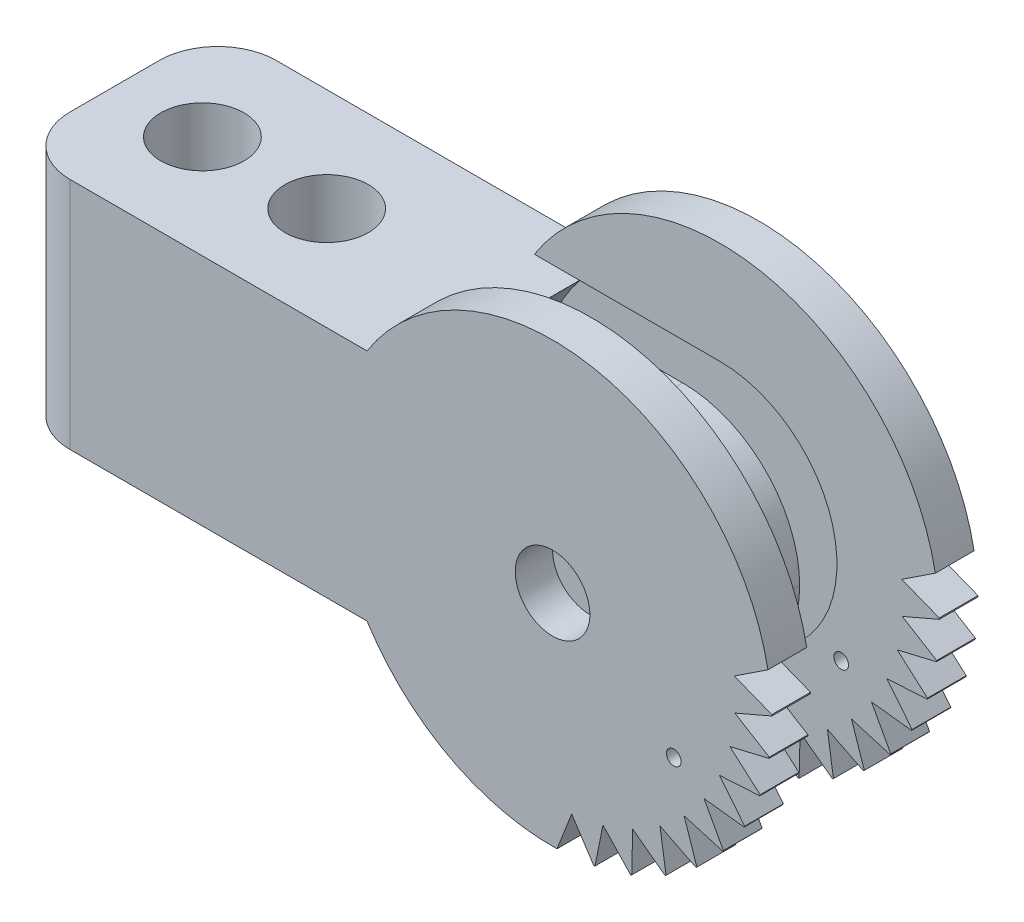
from build123d import *

# Parameters (mm, degrees)
SKETCH1_W           = 45
SKETCH1_H           = 16
BOSS_EXTRUDE1_DEPTH = 14.1
FILLET1_R           = 8
SKETCH2_R           = 1.65
CUT_EXTRUDE1_DEPTH  = 21.1
SKETCH4_R           = 12.5
CUT_EXTRUDE2_DEPTH  = 2.65
BOSS_EXTRUDE3_DEPTH = 2.65
SKETCH7_R           = 0.5
CUT_EXTRUDE3_DEPTH  = 2.65
FILLET2_R           = 4
SKETCH8_R           = 2.55
CUT_EXTRUDE4_DEPTH  = 21.65
SKETCH9_R           = 2.85
CUT_EXTRUDE5_DEPTH  = 6


with BuildPart() as part:
    # Sketch1 → Boss-Extrude1 (new body)
    with BuildSketch(Plane.XY):
        with Locations((-14.5, 0)):
            Rectangle(SKETCH1_W, SKETCH1_H)
    extrude(amount=BOSS_EXTRUDE1_DEPTH)

    # Fillet1
    fillet1_edges = [part.edges().sort_by_distance(p)[0] for p in [
        (8, -8, 7.05),
        (8, 8, 7.05),
    ]]
    fillet(fillet1_edges, radius=FILLET1_R - 0.0001)  # a hair under: the kernel refuses the full size

    # Sketch2 → Cut-Extrude1 (cut)
    with BuildSketch(Plane.XZ.offset(8)):
        with Locations((-22.5, 7.05)):
            Circle(SKETCH2_R)
        with Locations((-31, 7.05)):
            Circle(SKETCH2_R)
    extrude(amount=-CUT_EXTRUDE1_DEPTH, mode=Mode.SUBTRACT)

    # Sketch4 → Cut-Extrude2 (cut)
    with BuildSketch(Plane(origin=(0, 0, 2.55), x_dir=(-1, 0, 0), z_dir=(0, 0, -1))):
        Circle(SKETCH4_R)
    cut_extrude2 = extrude(amount=-CUT_EXTRUDE2_DEPTH, mode=Mode.SUBTRACT)

    # Mirror1: Cut-Extrude2 across plane
    add(cut_extrude2.mirror(Plane(origin=(0, 0, 7.05), x_dir=(1, 0, 0), z_dir=(0, 0, -1))), mode=Mode.SUBTRACT)

    # Sketch6 → Boss-Extrude3 (add)
    with BuildSketch(Plane(origin=(0, 0, 0), x_dir=(-1, 0, 0), z_dir=(0, 0, -1))):
        with BuildLine():
            Line((0, 8), (12.68857754, 8))
            ThreePointArc((12.68857754, 8), (-15, 0), (12.68857754, -8))
            Line((12.68857754, -8), (0, -8))
            ThreePointArc((0, -8), (-5.656854249, -5.656854249), (-8, 0))
            ThreePointArc((-8, 0), (-5.656854249, 5.656854249), (0, 8))
        make_face()
    boss_extrude3 = extrude(amount=-BOSS_EXTRUDE3_DEPTH)

    # Sketch7 → Cut-Extrude3 (cut)
    with BuildSketch(Plane(origin=(0, 0, 0), x_dir=(-1, 0, 0), z_dir=(0, 0, -1))):
        with BuildLine():
            Line((-10.362969657, -6.989911293), (-13.099285488, -7.308126963))
            ThreePointArc((-13.099285488, -7.308126963), (-12.435563588, -8.387893552), (-11.68305604, -9.407773465))
            Line((-11.68305604, -9.407773465), (-10.362969657, -6.989911293))
        make_face()
        with BuildLine():
            Line((-8.991747504, -8.683229631), (-11.631234978, -9.471767147))
            ThreePointArc((-11.631234978, -9.471767147), (-10.790097005, -10.419875557), (-9.871921449, -11.293589638))
            Line((-9.871921449, -11.293589638), (-8.991747504, -8.683229631))
        make_face()
        with BuildLine():
            Line((-7.347315654, -10.11271243), (-9.809775279, -11.347612479))
            ThreePointArc((-9.809775279, -11.347612479), (-8.816778784, -12.135254916), (-7.76083352, -12.836255804))
            Line((-7.76083352, -12.836255804), (-7.347315654, -10.11271243))
        make_face()
        with BuildLine():
            Line((-5.479639335, -11.234925579), (-7.690250522, -12.878666348))
            ThreePointArc((-7.690250522, -12.878666348), (-6.575567202, -13.481910694), (-5.413936592, -13.988898834))
            Line((-5.413936592, -13.988898834), (-5.479639335, -11.234925579))
        make_face()
        with BuildLine():
            Line((-3.445466948, -12.015771199), (-5.337061395, -14.018408457))
            ThreePointArc((-5.337061395, -14.018408457), (-4.134560337, -14.418925439), (-2.90253994, -14.716496251))
            Line((-2.90253994, -14.716496251), (-3.445466948, -12.015771199))
        make_face()
        with BuildLine():
            ThreePointArc((-14.808828542, -2.387173479), (-14.554435894, -3.628828434), (-14.196129578, -4.844574801))
            Line((-14.196129578, -4.844574801), (-12.128696578, -3.024023695))
            Line((-12.128696578, -3.024023695), (-14.808828542, -2.387173479))
        make_face()
        with BuildLine():
            ThreePointArc((-14.998377485, 0.22061914), (-14.963460754, -1.046347106), (-14.821710057, -2.305842793))
            Line((-14.821710057, -2.305842793), (-12.469550628, -0.871955922))
            Line((-12.469550628, -0.871955922), (-14.998377485, 0.22061914))
        make_face()
        with Locations((-8.290375726, -5.591929035)):
            Circle(SKETCH7_R)
        with BuildLine():
            Line((-1.306605791, -12.431523692), (-2.821708358, -14.732208319))
            ThreePointArc((-2.821708358, -14.732208319), (-1.567926949, -14.917828431), (-0.302951081, -14.996940376))
            Line((-0.302951081, -14.996940376), (-1.306605791, -12.431523692))
        make_face()
        with BuildLine():
            ThreePointArc((-14.732208319, 2.821708358), (-14.917828431, 1.567926949), (-14.996940376, 0.302951081))
            Line((-14.996940376, 0.302951081), (-12.431523692, 1.306605791))
            Line((-12.431523692, 1.306605791), (-14.732208319, 2.821708358))
        make_face()
        Polygon((-11.419318221, -5.084208038), (-13.206757578, -7.320625266), (-14.277330492, -4.916079132), align=None)
    cut_extrude3 = extrude(amount=-CUT_EXTRUDE3_DEPTH, mode=Mode.SUBTRACT)

    # Mirror8: Boss-Extrude3, Cut-Extrude3 across plane
    add(boss_extrude3.mirror(Plane(origin=(0, 0, 7.05), x_dir=(1, 0, 0), z_dir=(0, 0, -1))))
    add(cut_extrude3.mirror(Plane(origin=(0, 0, 7.05), x_dir=(1, 0, 0), z_dir=(0, 0, -1))), mode=Mode.SUBTRACT)

    # Fillet2
    fillet2_edges = [part.edges().sort_by_distance(p)[0] for p in [
        (-37, 0, 14.1),
        (-37, 0, 0),
    ]]
    fillet(fillet2_edges, radius=FILLET2_R)

    # Sketch8 → Cut-Extrude4 (cut)
    with BuildSketch(Plane(origin=(0, 0, 0), x_dir=(-1, 0, 0), z_dir=(0, 0, -1))):
        Circle(SKETCH8_R)
    extrude(amount=-CUT_EXTRUDE4_DEPTH, mode=Mode.SUBTRACT)

    # Sketch9 → Cut-Extrude5 (cut)
    with BuildSketch(Plane(origin=(0, 8, 0), x_dir=(1, 0, 0), z_dir=(0, 1, 0))):
        with Locations(Location((-31, -7.05, 0), (0, 0, 270))):
            Circle(SKETCH9_R)
        with Locations(Location((-22.5, -7.05, 0), (0, 0, 270))):
            Circle(SKETCH9_R)
    extrude(amount=-CUT_EXTRUDE5_DEPTH, mode=Mode.SUBTRACT)


solid = part.part
